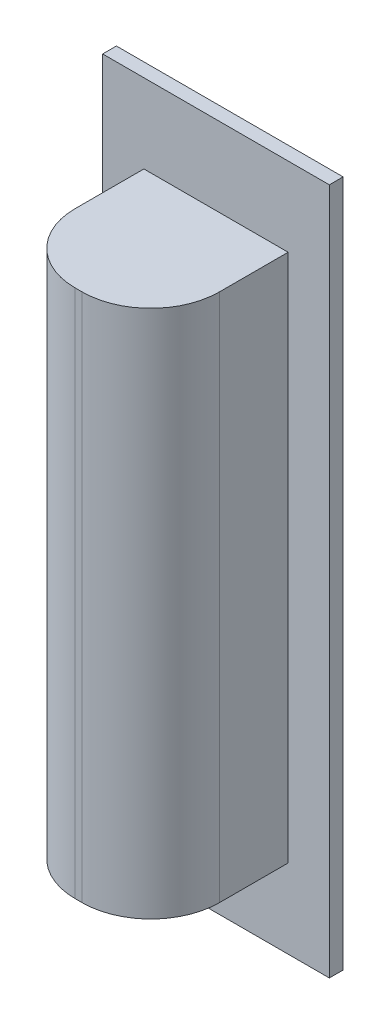
from build123d import *

# Parameters (mm, degrees)
SKETCH1_W           = 33
SKETCH1_H           = 100
BOSS_EXTRUDE1_DEPTH = 2
SKETCH4_W           = 21
SKETCH4_H           = 77
BOSS_EXTRUDE4_DEPTH = 20
FILLET2_R           = 10
SKETCH5_W           = 6
SKETCH5_H           = 6
BOSS_EXTRUDE5_DEPTH = 12
SKETCH6_R           = 3.125
BOSS_EXTRUDE6_DEPTH = 8.55


with BuildPart() as part:
    # Sketch1 → Boss-Extrude1 (new body)
    with BuildSketch(Plane.XY):
        Rectangle(SKETCH1_W, SKETCH1_H)
    extrude(amount=BOSS_EXTRUDE1_DEPTH)

    # Sketch4 → Boss-Extrude4 (add)
    with BuildSketch(Plane.XY.offset(2)):
        Rectangle(SKETCH4_W, SKETCH4_H)
    extrude(amount=BOSS_EXTRUDE4_DEPTH)

    # Fillet2
    fillet2_edges = [part.edges().sort_by_distance(p)[0] for p in [
        (-10.5, 0, 22),
        (10.5, 0, 22),
    ]]
    fillet(fillet2_edges, radius=FILLET2_R)

    # Sketch5 → Boss-Extrude5 (add)
    with BuildSketch(Plane(origin=(0, 0, 0), x_dir=(-1, 0, 0), z_dir=(0, 0, -1))):
        with Locations((8.25, -7.59)):
            Rectangle(SKETCH5_W, SKETCH5_H)
    extrude(amount=BOSS_EXTRUDE5_DEPTH)

    # Sketch6 → Boss-Extrude6 (add)
    with BuildSketch(Plane.ZY.offset(11.25)):
        with Locations((-8.72354754, -7.59)):
            Circle(SKETCH6_R)
    extrude(amount=BOSS_EXTRUDE6_DEPTH)


solid = part.part
